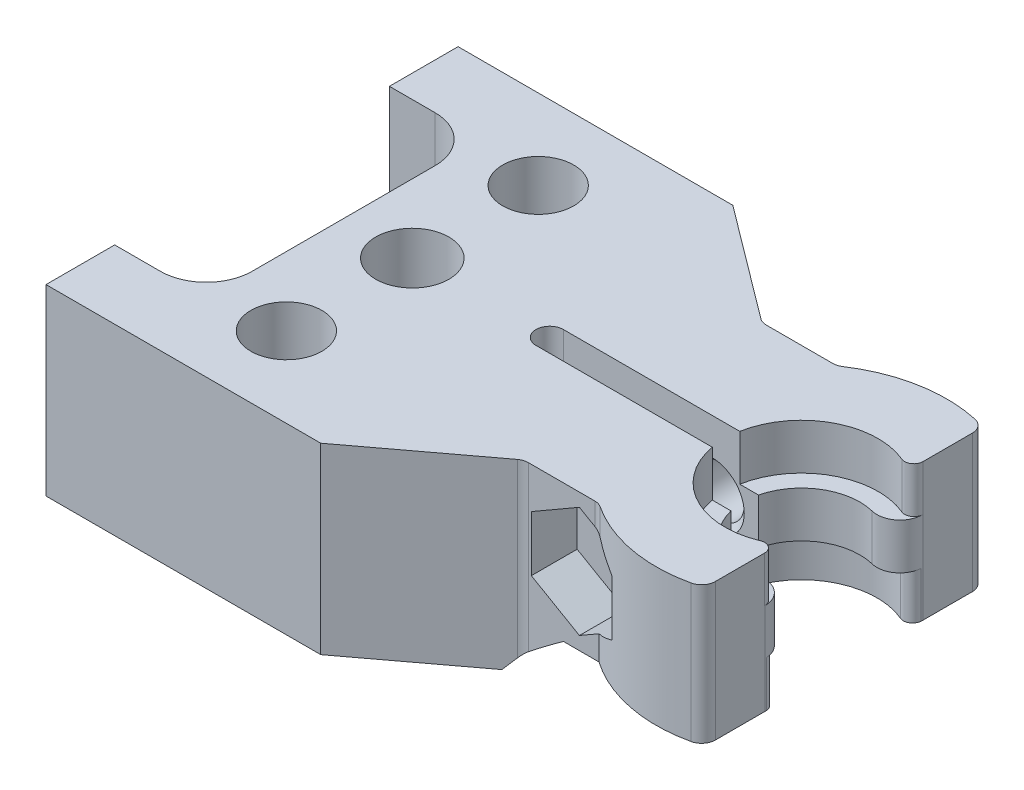
from build123d import *

# Parameters (mm, degrees)
SKETCH2_W               = 4
SKETCH2_H               = 3
SKETCH2_R               = 1.55
SKETCH2_R_2             = 1.6
BOSS_EXTRUDE1_DEPTH     = 8
SKETCH3_W               = 8.237002406
SKETCH3_H               = 20.610649192
CUT_EXTRUDE1_DEPTH      = 43.579337712
CHAMFER1_SIZE           = 3
FILLET4_R               = 1
FILLET5_R               = 0.4
FILLET6_R               = 2
CUT_EXTRUDE2_DEPTH      = 43.579337712
SKETCH7_R               = 2.5
SKETCH7_R_2             = 1.6
BOSS_EXTRUDE2_DEPTH     = 0.5
CHAMFER2_SIZE           = 0.5
CUT_EXTRUDE4_DEPTH      = 43.579337712
CUT_EXTRUDE4_DEPTH_BACK = 43.579337712
SKETCH8_R               = 1.1
FILLET7_R               = 0.6
CHAMFER3_SIZE           = 0.3
CUT_EXTRUDE5_DEPTH      = 1.2
CUT_EXTRUDE5_DEPTH_BACK = 2
CUT_EXTRUDE6_DEPTH      = 10
CUT_EXTRUDE6_DEPTH_BACK = 2
SKETCH11_R              = 1.95


# Some blends are built 0.0001 mm under size
with BuildPart() as part:
    # Sketch1 → Revolve1 (revolve)
    with BuildSketch(Plane.XY, mode=Mode.PRIVATE) as revolve1_sk:
        Polygon((-3.35, 34), (-3.35, 32), (-2.55, 32), (-2.55, 30), (-3.3, 30), (-3.3, 28), (-6.35, 28), (-6.35, 34), align=None)
    revolve(revolve1_sk.sketch.rotate(Axis((0, 0, 0), (0, 1, 0)), 270), axis=Axis((0, 0, 0), (0, 1, 0)))

    # Sketch2 → Boss-Extrude1 (add)
    # profile 1 of 6: a face of its own
    with BuildSketch(Plane(origin=(0, 34, 0), x_dir=(1, 0, 0), z_dir=(0, 1, 0))):
        with Locations((-22, 7.5)):
            Rectangle(SKETCH2_W, SKETCH2_H)
    # profile 2 of 6: a face of its own
    with BuildSketch(Plane(origin=(0, 34, 0), x_dir=(1, 0, 0), z_dir=(0, 1, 0))):
        with Locations((-22, -7.5)):
            Rectangle(SKETCH2_W, SKETCH2_H)
    # profile 3 of 6: a face of its own
    with BuildSketch(Plane(origin=(0, 34, 0), x_dir=(1, 0, 0), z_dir=(0, 1, 0))):
        Polygon((-12, 9), (-20, 9), (-20, 6), (-20, -6), (-20, -9), (-12, -9), (-6.933333333, -5.2), (-8.990544831, -5.2), (-8.990544831, 5.2), (-6.933333333, 5.2), align=None)
        with Locations(Location((-17, -5.5, 0), (0, 0, 270))):
            Circle(SKETCH2_R, mode=Mode.SUBTRACT)
        with Locations(Location((-17, 0, 0), (0, 0, 270))):
            Circle(SKETCH2_R_2, mode=Mode.SUBTRACT)
        with Locations(Location((-17, 5.5, 0), (0, 0, 270))):
            Circle(SKETCH2_R, mode=Mode.SUBTRACT)
    # profile 4 of 6: a face of its own
    with BuildSketch(Plane(origin=(0, 34, 0), x_dir=(1, 0, 0), z_dir=(0, 1, 0))):
        with BuildLine():
            Line((-5.08, 3.81), (-6.933333333, 5.2))
            Line((-6.933333333, 5.2), (-8.990544831, 5.2))
            Line((-8.990544831, 5.2), (-8.990544831, -5.2))
            Line((-8.990544831, -5.2), (-6.933333333, -5.2))
            Line((-6.933333333, -5.2), (-5.08, -3.81))
            ThreePointArc((-5.08, -3.81), (-6.35, 0), (-5.08, 3.81))
        make_face()
    # profile 5 of 6: a face of its own
    with BuildSketch(Plane(origin=(0, 34, 0), x_dir=(1, 0, 0), z_dir=(0, 1, 0))):
        with BuildLine():
            Line((-3.644516429, 5.2), (-6.933333333, 5.2))
            Line((-6.933333333, 5.2), (-5.08, 3.81))
            ThreePointArc((-5.08, 3.81), (-4.417275374, 4.561817431), (-3.644516429, 5.2))
        make_face()
    # profile 6 of 6: a face of its own
    with BuildSketch(Plane(origin=(0, 34, 0), x_dir=(1, 0, 0), z_dir=(0, 1, 0))):
        with BuildLine():
            ThreePointArc((-3.644516429, -5.2), (-4.417275374, -4.561817431), (-5.08, -3.81))
            Line((-5.08, -3.81), (-6.933333333, -5.2))
            Line((-6.933333333, -5.2), (-3.644516429, -5.2))
        make_face()
    extrude(amount=-BOSS_EXTRUDE1_DEPTH)

    # Sketch3 → Cut-Extrude1 (cut, through all)
    with BuildSketch(Plane(origin=(0, 0, 0), x_dir=(1, 0, 0), z_dir=(0, 1, 0))):
        with Locations((5.968501203, -0.12700224)):
            Rectangle(SKETCH3_W, SKETCH3_H)
    extrude(amount=CUT_EXTRUDE1_DEPTH, mode=Mode.SUBTRACT)

    # Chamfer1
    # the kernel refuses this chamfer: 3 mm, written as the material it adds along each edge
    # the kernel refuses this chamfer: 3 mm, written as the material it takes off along each edge
    with BuildSketch(Plane(origin=(0, 26, 0), x_dir=(0.568258769278242, 0, -0.8228499080259886), z_dir=(0.8228499080259886, 0, 0.568258769278242))) as chamfer1_2_piece_1_section:
        Polygon((6.35 + CHAMFER1_SIZE, 0), (6.35, CHAMFER1_SIZE), (6.35, 0), align=None)
    chamfer1_2_piece_1 = revolve(axis=Axis((0, 26, 0), (0, 1, 0)), revolution_arc=249.257786961, mode=Mode.PRIVATE)
    chamfer1_2_piece_1 = split(chamfer1_2_piece_1, bisect_by=Plane(origin=(-8.355666821, 28, 0), z_dir=(0, -1, 0)), keep=Keep.TOP, mode=Mode.PRIVATE)
    add(chamfer1_2_piece_1, mode=Mode.SUBTRACT)

    # Fillet4
    fillet4_edges = [part.edges().sort_by_distance(p)[0] for p in [
        (1.85, 31, 1.754992877),
        (1.85, 31, -1.754992877),
    ]]
    fillet(fillet4_edges, radius=FILLET4_R)

    # Fillet5
    # the kernel refuses this fillet: 0.4 mm, written as the material it takes off along each edge
    with BuildSketch(Plane(origin=(1.684476075, 35.466182436, -2.895693415), x_dir=(-0.8951889914868396, 0, -0.4456867392247326), z_dir=(0, -1, 0))) as fillet5_piece_1:
        with BuildLine():
            CenterArc((0.460657077, 0.399157196), FILLET5_R, 153.532715484, 112.747248008)
            Line((0.10258148, 0.577431892), (0.06677392, 0.595259361))
            ThreePointArc((0.06677392, 0.595259361), (0.061610325, 0.584887966), (-0.039704275, -0.00485495))
            Line((-0.039704275, -0.00485495), (0.002595251, -0.03991572))
            ThreePointArc((0.002595251, -0.03991572), (0.217352283, -0.032941517), (0.432109314, -0.03991572))
            Line((0.432109314, -0.03991572), (0.434704565, 0))
        make_face()
    extrude(amount=3.466182436, mode=Mode.SUBTRACT)
    with BuildSketch(Plane(origin=(1.655788422, 26.609524103, -2.85453406), x_dir=(0.3447573093533237, 0, -0.938691854469536), z_dir=(0, 1, 0))) as fillet5_piece_2:
        with BuildLine():
            CenterArc((0.444952287, 0.384221409), FILLET5_R, 177.1195622, 109.026989702)
            ThreePointArc((0.045457658, 0.404322189), (0.028966063, 0.201459847), (0, 0))
            ThreePointArc((0, 0), (0.278095179, -0.039446477), (0.556190359, 0))
        make_face()
    extrude(amount=3.390475897, mode=Mode.SUBTRACT)
    with BuildSketch(Plane(origin=(1.655788422, 26.609524103, 2.85453406), x_dir=(0.3447573093533235, 0, 0.9386918544695363), z_dir=(0, 1, 0))) as fillet5_piece_3:
        with BuildLine():
            CenterArc((0.444952287, -0.384221409), FILLET5_R, 73.853448098, 109.026989702)
            ThreePointArc((0.045457658, -0.404322189), (0.028966063, -0.201459847), (0, 0))
            ThreePointArc((0, 0), (0.278095179, 0.039446477), (0.556190359, 0))
        make_face()
    extrude(amount=3.390475897, mode=Mode.SUBTRACT)
    with BuildSketch(Plane(origin=(1.684476075, 35.466182436, 2.895693415), x_dir=(-0.8951889914868395, 0, 0.44568673922473334), z_dir=(0, -1, 0))) as fillet5_piece_4:
        with BuildLine():
            CenterArc((0.460657077, -0.399157196), FILLET5_R, 93.720036508, 112.747248008)
            Line((0.10258148, -0.577431892), (0.06677392, -0.595259361))
            ThreePointArc((0.06677392, -0.595259361), (0.061610325, -0.584887966), (-0.039704275, 0.00485495))
            Line((-0.039704275, 0.00485495), (0.002595251, 0.03991572))
            ThreePointArc((0.002595251, 0.03991572), (0.217352283, 0.032941517), (0.432109314, 0.03991572))
            Line((0.432109314, 0.03991572), (0.434704565, 0))
        make_face()
    extrude(amount=3.466182436, mode=Mode.SUBTRACT)

    # Fillet6
    fillet6_edges = [part.edges().sort_by_distance(p)[0] for p in [
        (-20, 30, 6),
        (-20, 30, -6),
    ]]
    fillet(fillet6_edges, radius=FILLET6_R)

    # Sketch5 → Cut-Extrude2 (cut, through all)
    with BuildSketch(Plane(origin=(0, 0, 0), x_dir=(1, 0, 0), z_dir=(0, 1, 0))):
        with BuildLine():
            Line((0, -0.6), (-11, -0.6))
            ThreePointArc((-11, -0.6), (-11.6, 0), (-11, 0.6))
            Line((-11, 0.6), (0, 0.6))
            ThreePointArc((0, 0.6), (0.6, 0), (0, -0.6))
        make_face()
    extrude(amount=CUT_EXTRUDE2_DEPTH, mode=Mode.SUBTRACT)

    # Sketch7 → Boss-Extrude2 (add)
    with BuildSketch(Plane.XZ.offset(-26)):
        with Locations(Location((-17, 0, 0), (0, 0, 90))):
            Circle(SKETCH7_R)
        with Locations(Location((-17, 0, 0), (0, 0, 90))):
            Circle(SKETCH7_R_2, mode=Mode.SUBTRACT)
    extrude(amount=BOSS_EXTRUDE2_DEPTH)

    # Chamfer2
    chamfer2_edges = [part.edges().sort_by_distance(p)[0] for p in [
        (-17, 26, -2.5),
    ]]
    chamfer(chamfer2_edges, length=CHAMFER2_SIZE - 0.0001)  # a hair under: the kernel refuses the full size

    # Sketch8 → Cut-Extrude4 (cut, two sides: drawn at the far end of the back side and taken through both)
    with BuildSketch(Plane.XY.offset(-CUT_EXTRUDE4_DEPTH_BACK)):
        with Locations(Location((-4.5, 31, 0), (0, 0, 321.051593768))):
            Circle(SKETCH8_R)
    extrude(amount=CUT_EXTRUDE4_DEPTH + CUT_EXTRUDE4_DEPTH_BACK, mode=Mode.SUBTRACT)

    # Fillet7
    fillet7_edges = [part.edges().sort_by_distance(p)[0] for p in [
        (-3.644516429, 32.845741182, 5.2),
        (-3.644516429, 32.845741182, -5.2),
        (1.85, 31, 6.074537019),
        (1.85, 31, -6.074537019),
        (-6.933333333, 30.341666667, 5.2),
        (-6.933333333, 30.341666667, -5.2),
    ]]
    fillet(fillet7_edges, radius=FILLET7_R)

    # Chamfer3
    chamfer3_edges = [part.edges().sort_by_distance(p)[0] for p in [
        (-5.355483571, 31.691482364, 0.6),
        (-5.355483571, 31.691482364, -0.6),
    ]]
    chamfer(chamfer3_edges, length=CHAMFER3_SIZE)

    # Sketch10 → Cut-Extrude5 (cut, two sides: drawn at the far end of the back side and taken through both)
    with BuildSketch(Plane.XY.offset(5.2).offset(-CUT_EXTRUDE5_DEPTH_BACK)):
        Polygon((-4.5, 28.575128869), (-2.4, 29.787564435), (-2.4, 32.212435565), (-4.5, 33.424871131), (-6.6, 32.212435565), (-6.6, 29.787564435), align=None)
    extrude(amount=CUT_EXTRUDE5_DEPTH + CUT_EXTRUDE5_DEPTH_BACK, mode=Mode.SUBTRACT)

    # Sketch11 → Cut-Extrude6 (cut, two sides: drawn at the far end of the back side and taken through both)
    with BuildSketch(Plane(origin=(0, 0, -5.2), x_dir=(-1, 0, 0), z_dir=(0, 0, -1)).offset(-CUT_EXTRUDE6_DEPTH_BACK)):
        with Locations(Location((4.5, 31, 0), (0, 0, 120.900188268))):
            Circle(SKETCH11_R)
    extrude(amount=CUT_EXTRUDE6_DEPTH + CUT_EXTRUDE6_DEPTH_BACK, mode=Mode.SUBTRACT)


solid = part.part
